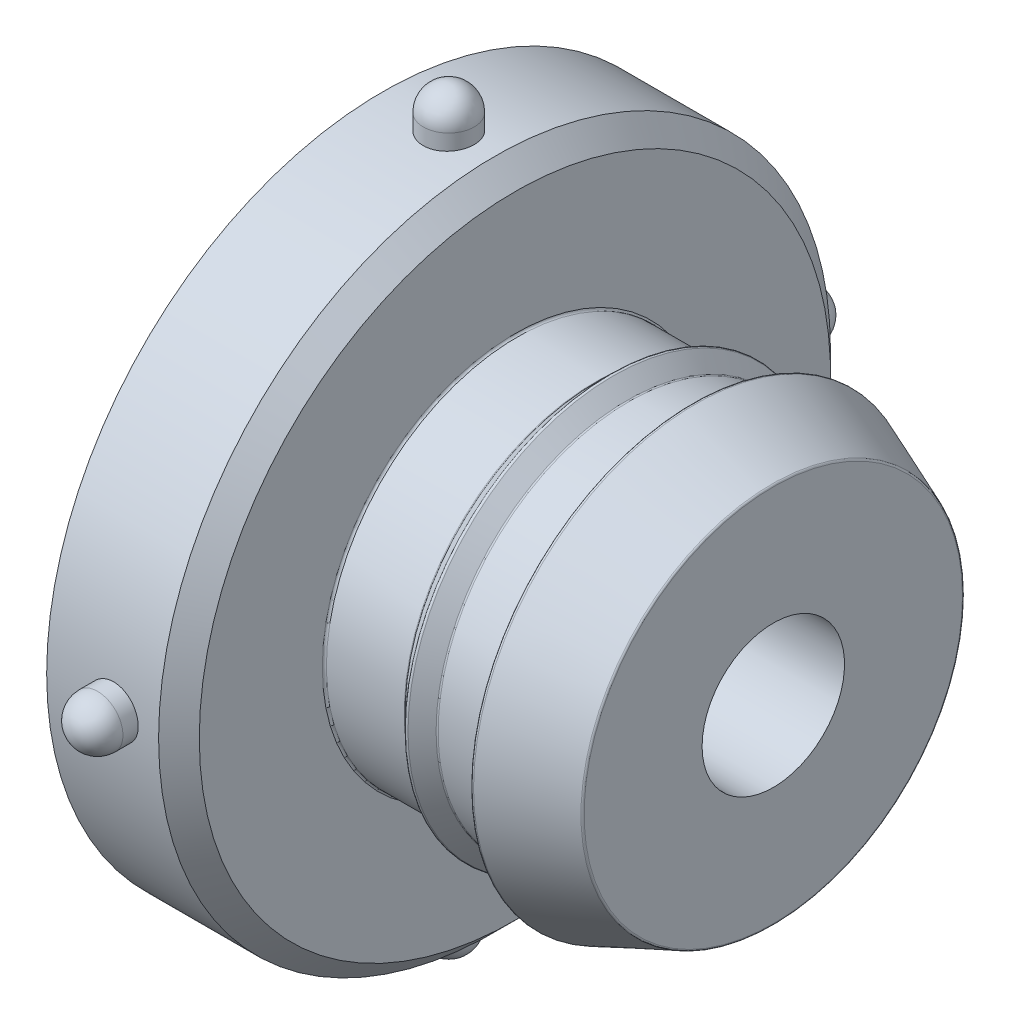
from build123d import *

# Parameters (mm, degrees)
SKETCH2_R            = 16.51
SKETCH2_R_2          = 3.5
BOSS_EXTRUDE1_DEPTH  = 1.5
SKETCH2_4_R          = 0.9
BOSS_EXTRUDE3_DEPTH  = 5
SKETCH2_5_R          = 3.5
SKETCH2_5_W          = 2.46
SKETCH2_5_H          = 4.35
CUT_EXTRUDE1_DEPTH   = 27.579130911
BOSS_EXTRUDE4_START  = 1.5
SKETCH2_6_R          = 16.51
SKETCH2_6_W          = 18.58
SKETCH2_6_H          = 14.05
BOSS_EXTRUDE4_DEPTH  = 5
FILLET1_R            = 0.1
FILLET4_R            = 0.2
CUT_SWEEP1_PROFILE_R = 0.9
SKETCH17_R           = 1.25
BOSS_EXTRUDE5_DEPTH  = 2
SKETCH17_3_R         = 1.25
BOSS_EXTRUDE6_DEPTH  = 0.5
FILLET6_R            = 1.25
CHAMFER1_SIZE        = 1
SKETCH18_W           = 4.75
SKETCH18_H           = 7.65
BOSS_EXTRUDE7_DEPTH  = 0.64
FILLET7_R            = 0.5
CHAMFER2_SIZE        = 1


# Read off the part's stored shape, not the designer's step: CirPattern10
with BuildPart() as part:
    # Sketch1 → Revolve1 (revolve)
    with BuildSketch(Plane(origin=(0, 0, 0), x_dir=(1, 0, 0), z_dir=(0, 1, 0))):
        Polygon((0, 0), (-12.7, 0), (-12.7, 9.365), (-8.73, 9.365), (-7.94, 10.155), (-7.15, 9.365), (-3.97, 9.365), (-3.97, 10.955), (0, 9.365), align=None)
    revolve(axis=Axis((0, 0, 0), (-1, 0, 0)))

    # Sketch2 → Boss-Extrude1 (add)
    with BuildSketch(Plane.ZY.offset(12.7)):
        Circle(SKETCH2_R)
        Circle(SKETCH2_R_2, mode=Mode.SUBTRACT)
    extrude(amount=BOSS_EXTRUDE1_DEPTH)

    # Sketch2<4> → Boss-Extrude3 (add)
    with BuildSketch(Plane.ZY.offset(12.7)):
        with Locations((6.19, 3.935)):
            Circle(SKETCH2_4_R)
        with Locations((-6.19, 3.935)):
            Circle(SKETCH2_4_R)
    extrude(amount=BOSS_EXTRUDE3_DEPTH)

    # Sketch2<5> → Cut-Extrude1 (cut, through all)
    # profile 1 of 2: a face of its own
    with BuildSketch(Plane.ZY.offset(12.7)):
        Circle(SKETCH2_5_R)
        with Locations((-0.31, 0.56)):
            Rectangle(SKETCH2_5_W, SKETCH2_5_H, mode=Mode.SUBTRACT)
    # profile 2 of 2: a face of its own
    with BuildSketch(Plane.ZY.offset(12.7)):
        with Locations((-0.31, 0.56)):
            Rectangle(SKETCH2_5_W, SKETCH2_5_H)
    extrude(amount=-CUT_EXTRUDE1_DEPTH, mode=Mode.SUBTRACT)

    # Sketch2<6> → Boss-Extrude4 (add)
    with BuildSketch(Plane.ZY.offset(12.7).offset(BOSS_EXTRUDE4_START)):
        Circle(SKETCH2_6_R)
        with Locations((0, -0.4)):
            Rectangle(SKETCH2_6_W, SKETCH2_6_H, mode=Mode.SUBTRACT)
    extrude(amount=BOSS_EXTRUDE4_DEPTH)

    # Fillet1
    fillet1_edges = [part.edges().sort_by_distance(p)[0] for p in [
        (-3.97, 0, 9.365),
        (-3.97, 0, 10.955),
        (0, 0, 9.365),
        (-12.7, 0, 9.365),
        (-8.73, 0, 9.365),
        (-7.94, 0, 10.155),
        (-7.15, 0, 9.365),
    ]]
    fillet(fillet1_edges, radius=FILLET1_R)

    # Fillet4
    fillet4_edges = [part.edges().sort_by_distance(p)[0] for p in [
        (-17.7, 3.935, 5.29),
        (-17.7, 3.935, -7.09),
    ]]
    fillet(fillet4_edges, radius=FILLET4_R)

    # Cut-Sweep1: sweep along a path in Sketch8
    with BuildLine(Plane.ZY.offset(19.2)) as cut_sweep1_path:
        CenterArc((0, 0), 14.14145, 0, 360)
    # Cut-Sweep1 profile (on start of the path) → Cut-Sweep1 (sweep, cut)
    with BuildSketch(Plane(origin=(-19.2, 0, 14.14145), x_dir=(0, 0, 1), z_dir=(0, 1, 0))):
        Circle(CUT_SWEEP1_PROFILE_R)
    sweep(path=cut_sweep1_path.line, mode=Mode.SUBTRACT)



with BuildPart() as body_2:
    # Sketch17 → Boss-Extrude5 (new body)
    with BuildSketch(Plane(origin=(0, -16.51, 0), x_dir=(-1, 0, 0), z_dir=(0, -1, 0))):
        with Locations(Location((15.95, 0, 0), (0, 0, 90))):
            Circle(SKETCH17_R)
    extrude(amount=BOSS_EXTRUDE5_DEPTH)


with BuildPart() as part_1:
    add(part.part)

    add(body_2.part)  # Boss-Extrude6 merges body 2
    # Sketch17<3> → Boss-Extrude6 (add)
    with BuildSketch(Plane(origin=(0, -16.51, 0), x_dir=(-1, 0, 0), z_dir=(0, -1, 0))):
        with Locations(Location((15.95, 0, 0), (0, 0, 90))):
            Circle(SKETCH17_3_R)
    extrude(amount=-BOSS_EXTRUDE6_DEPTH)

    # Fillet6
    fillet6_edges = [part_1.edges().sort_by_distance(p)[0] for p in [
        (-15.95, -18.51, 1.25),
    ]]
    fillet(fillet6_edges, radius=FILLET6_R)

    # CirPattern10 outline → CirPattern10 (revolve)
    with BuildSketch(Plane(origin=(-15.95, 0, 0), x_dir=(1, 0, 0), z_dir=(0, 0, 1))):
        with BuildLine():
            Line((0, 16.462586639), (1.25, 16.462586639))
            Line((1.25, 16.462586639), (1.25, 17.259999999))
            ThreePointArc((1.25, 17.259999999), (0.883883477, 18.143883476), (0, 18.51))
            Line((0, 18.51), (0, 16.462586639))
        make_face()
    revolve(axis=Axis((-15.95, 0, 0), (0, 1, 0)))

    # CirPattern10 2 outline → CirPattern10 2 (revolve)
    with BuildSketch(Plane(origin=(-15.95, 0, 0), x_dir=(1, 0, 0), z_dir=(0, -1, 0))):
        with BuildLine():
            Line((1.25, 16.462592789), (1.25, 17.259999999))
            ThreePointArc((1.25, 17.259999999), (0.883883477, 18.143883476), (0, 18.51))
            Line((0, 18.51), (0, 16.462592789))
            Line((0, 16.462592789), (1.25, 16.462592789))
        make_face()
        with BuildLine():
            Line((1.25, -17.259999999), (1.25, -16.462586639))
            Line((1.25, -16.462586639), (0, -16.462586639))
            Line((0, -16.462586639), (0, -18.51))
            ThreePointArc((0, -18.51), (0.883883477, -18.143883476), (1.25, -17.259999999))
        make_face()
    revolve(axis=Axis((-15.95, 0, 0), (0, 0, 1)))

    # Chamfer1
    chamfer1_edges = [part_1.edges().sort_by_distance(p)[0] for p in [
        (-12.7, 0, -16.51),
    ]]
    chamfer(chamfer1_edges, length=CHAMFER1_SIZE)

    # Sketch18 → Boss-Extrude7 (add)
    with BuildSketch(Plane.ZY.offset(14.2)):
        with Locations((-6.915, -3.6)):
            Rectangle(SKETCH18_W, SKETCH18_H)
    extrude(amount=BOSS_EXTRUDE7_DEPTH)

    # Fillet7
    fillet7_edges = [part_1.edges().sort_by_distance(p)[0] for p in [
        (-14.84, -3.6, -4.54),
        (-14.84, 0.225, -6.915),
    ]]
    fillet(fillet7_edges, radius=FILLET7_R)

    # Chamfer2
    chamfer2_edges = [part_1.edges().sort_by_distance(p)[0] for p in [
        (-14.2, 0, -3.5),
    ]]
    chamfer(chamfer2_edges, length=CHAMFER2_SIZE)


solid = part_1.part
